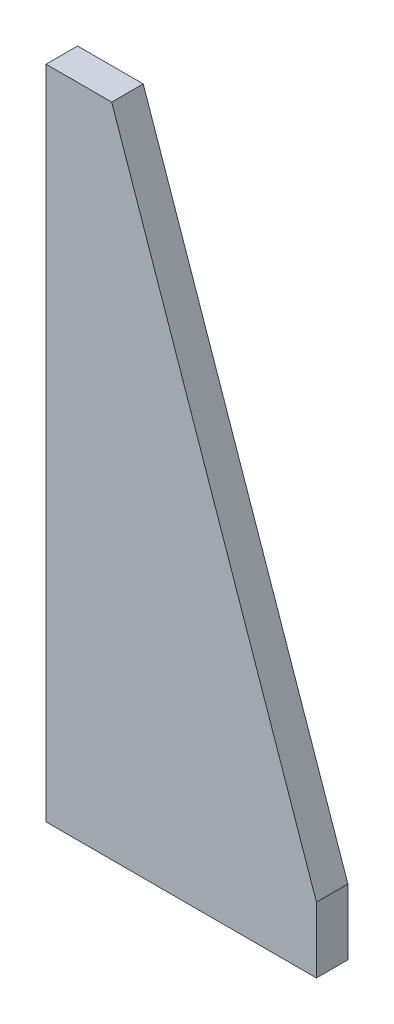
from build123d import *

# Parameters (mm, degrees)
FLANGE_BASE1_DEPTH = 4.8


# Sheet-metal steps are written as plain solids
with BuildPart() as part:
    # Esboço1 → Flange-base1 (new body)
    with BuildSketch(Plane.XY):
        Polygon((0, 0), (41.2, 0), (41.2, 10), (10, 100), (0, 100), align=None)
    extrude(amount=-FLANGE_BASE1_DEPTH)


solid = part.part
